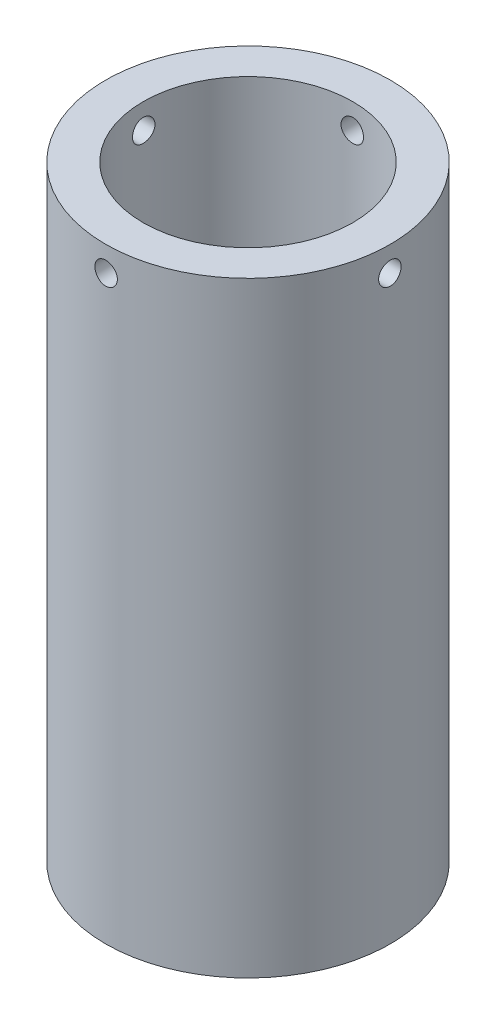
from build123d import *

# Parameters (mm, degrees)
SKETCH1_R           = 28.5
SKETCH1_R_2         = 21
BOSS_EXTRUDE1_DEPTH = 60.675
SKETCH2_R           = 2.25
CUT_EXTRUDE1_DEPTH  = 73.841990809
CIRPATTERN1_COUNT   = 4
SKETCH3_R           = 2.25
CUT_EXTRUDE2_DEPTH  = 6.5


with BuildPart() as part:
    # Sketch1 → Boss-Extrude1 (new, symmetric)
    with BuildSketch(Plane(origin=(0, 0, 0), x_dir=(1, 0, 0), z_dir=(0, 1, 0))):
        Circle(SKETCH1_R)
        Circle(SKETCH1_R_2, mode=Mode.SUBTRACT)
    extrude(amount=BOSS_EXTRUDE1_DEPTH, both=True)

    # Sketch2 → Cut-Extrude1 (cut, through all)
    with BuildSketch(Plane.XY):
        with Locations((0, 55.675)):
            Circle(SKETCH2_R)
    cut_extrude1 = extrude(amount=-CUT_EXTRUDE1_DEPTH, mode=Mode.SUBTRACT)

    # CirPattern1: Cut-Extrude1 ×4 about axis
    cirpattern1_axis = Axis((0, 60.675, 0), (0, -1, 0))
    for i in range(1, CIRPATTERN1_COUNT):
        add(cut_extrude1.rotate(cirpattern1_axis, i * 360 / CIRPATTERN1_COUNT), mode=Mode.SUBTRACT)

    # Sketch3 → Cut-Extrude2 (cut)
    with BuildSketch(Plane.XZ.offset(60.675)):
        with Locations((0, 24.75)):
            Circle(SKETCH3_R)
        with Locations((24.75, 0)):
            Circle(SKETCH3_R)
        with Locations((0, -24.75)):
            Circle(SKETCH3_R)
        with Locations((-24.75, 0)):
            Circle(SKETCH3_R)
    extrude(amount=-CUT_EXTRUDE2_DEPTH, mode=Mode.SUBTRACT)


solid = part.part
